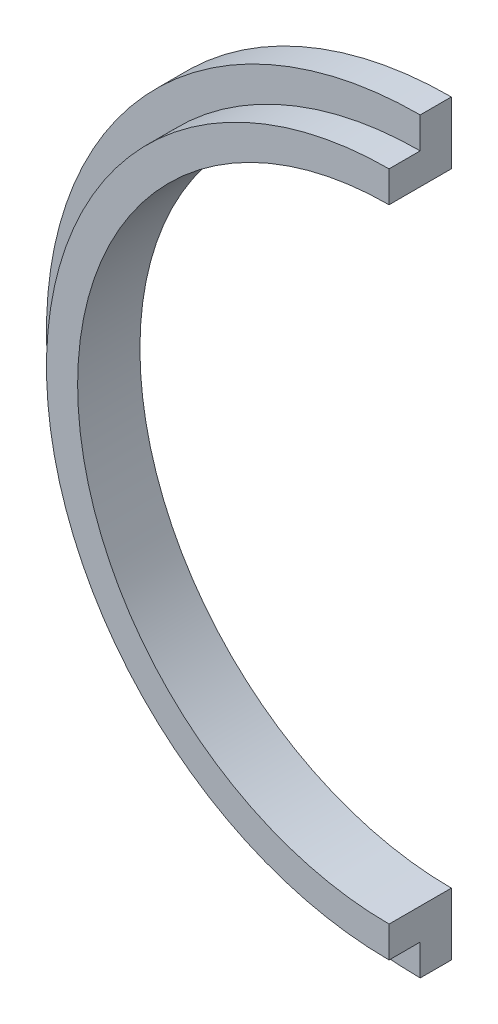
from build123d import *

# Parameters (mm, degrees)
SKETCH1_R           = 180
SKETCH1_R_2         = 150
BOSS_EXTRUDE1_DEPTH = 15
SKETCH2_R           = 165
SKETCH2_R_2         = 150
BOSS_EXTRUDE2_DEPTH = 15
CUT_EXTRUDE1_REACH  = 258.32
SKETCH3_W           = 245
SKETCH3_H           = 360


with BuildPart() as part:
    # Sketch1 → Boss-Extrude1 (new body)
    with BuildSketch(Plane.XY):
        Circle(SKETCH1_R)
        Circle(SKETCH1_R_2, mode=Mode.SUBTRACT)
    extrude(amount=BOSS_EXTRUDE1_DEPTH)

    # Sketch2 → Boss-Extrude2 (add)
    with BuildSketch(Plane.XY.offset(15)):
        Circle(SKETCH2_R)
        Circle(SKETCH2_R_2, mode=Mode.SUBTRACT)
    extrude(amount=BOSS_EXTRUDE2_DEPTH)

    # Sketch3 → Cut-Extrude1 (cut, up to next)
    with BuildSketch(Plane.XY, mode=Mode.PRIVATE) as cut_extrude1_sk1:
        with Locations((122.5, 0)):
            Rectangle(SKETCH3_W, SKETCH3_H)
    cut_extrude1_tool1 = extrude(cut_extrude1_sk1.sketch, amount=CUT_EXTRUDE1_REACH, mode=Mode.PRIVATE) & part.part
    add(cut_extrude1_tool1.solids().sort_by_distance((122.5, 0, 0))[0], mode=Mode.SUBTRACT)


solid = part.part
